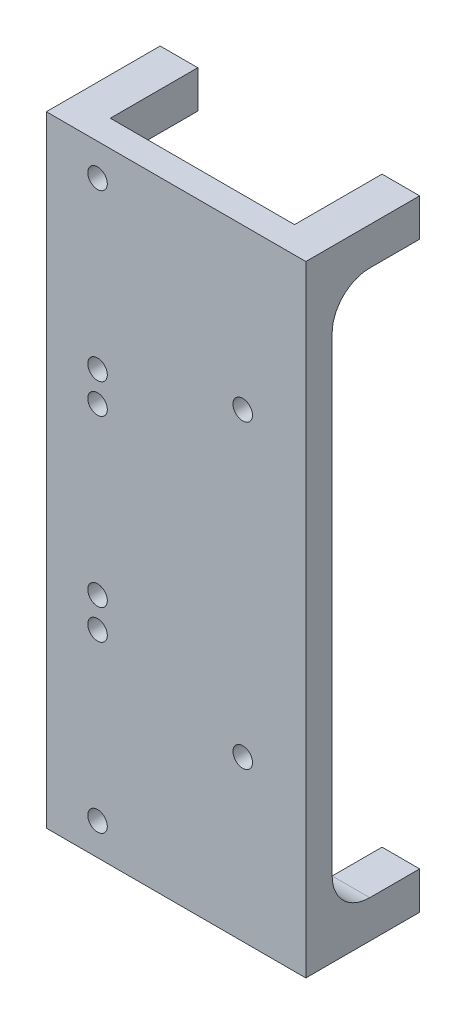
from build123d import *

# Parameters (mm, degrees)
SKETCH1_W            = 69
SKETCH1_H            = 165
BOSS_EXTRUDE1_DEPTH  = 7
SKETCH3_R            = 2.6
CUT_EXTRUDE2_DEPTH   = 7
SKETCH2_R            = 2.6
CUT_EXTRUDE1_DEPTH   = 7
SKETCH5_W            = 10
SKETCH5_H            = 10
BOSS_EXTRUDE2_DEPTH  = 23.264128691
SKETCH6_R            = 2.25
CUT_EXTRUDE3_DEPTH   = 10
FILLET1_R            = 10
FILLET1_OF_MIRROR1_R = 10
MIRROR2_START        = 123.910418582
MIRROR2_DEPTH        = 2.75
MIRROR2_START_2      = 116.660418582
MIRROR2_2_DEPTH      = 2.7499999
MIRROR2_START_3      = 119.410418482
MIRROR2_3_DEPTH      = 4.5000001
MIRROR2_START_4      = -23.264128691
MIRROR2_4_OUTLINE_R  = 2.25
MIRROR2_4_DEPTH      = 10


with BuildPart() as part:
    # Sketch1 → Boss-Extrude1 (new body)
    with BuildSketch(Plane.XY):
        with Locations((92.160418582, 14.328579343)):
            Rectangle(SKETCH1_W, SKETCH1_H)
    extrude(amount=BOSS_EXTRUDE1_DEPTH)

    # Sketch3 → Cut-Extrude2 (cut)
    with BuildSketch(Plane.XY.offset(7)):
        with Locations((109.883329943, 54.328579343)):
            Circle(SKETCH3_R)
        with Locations((109.883329943, -25.671420657)):
            Circle(SKETCH3_R)
    extrude(amount=-CUT_EXTRUDE2_DEPTH, mode=Mode.SUBTRACT)

    # Sketch2 → Cut-Extrude1 (cut)
    with BuildSketch(Plane.XY.offset(7)):
        with Locations((71.267526747, -59.671420657)):
            Circle(SKETCH2_R)
        with Locations((71.267526747, -15.671420657)):
            Circle(SKETCH2_R)
        with Locations((71.267526747, -7.671420657)):
            Circle(SKETCH2_R)
        with Locations((71.267526747, 36.328579343)):
            Circle(SKETCH2_R)
        with Locations((71.267526747, 44.328579343)):
            Circle(SKETCH2_R)
        with Locations((71.267526747, 88.328579343)):
            Circle(SKETCH2_R)
    extrude(amount=-CUT_EXTRUDE1_DEPTH, mode=Mode.SUBTRACT)

    # Sketch5 → Boss-Extrude2 (add)
    with BuildSketch(Plane(origin=(0, 0, 0), x_dir=(-1, 0, 0), z_dir=(0, 0, -1))):
        with Locations((-62.660418582, -63.171420657)):
            Rectangle(SKETCH5_W, SKETCH5_H)
    boss_extrude2 = extrude(amount=BOSS_EXTRUDE2_DEPTH)

    # Sketch6 → Cut-Extrude3 (cut)
    with BuildSketch(Plane(origin=(0, 0, -23.264128691), x_dir=(-1, 0, 0), z_dir=(0, 0, -1))):
        with Locations(Location((-62.660418582, -63.171420657, 0), (0, 0, 90))):
            Circle(SKETCH6_R)
    cut_extrude3 = extrude(amount=-CUT_EXTRUDE3_DEPTH, mode=Mode.SUBTRACT)

    # Fillet1
    fillet1_edges = [part.edges().sort_by_distance(p)[0] for p in [
        (62.660418582, -58.171420657, 0),
    ]]
    fillet(fillet1_edges, radius=FILLET1_R)

    # Mirror1: Boss-Extrude2, Cut-Extrude3 across plane
    add(boss_extrude2.mirror(Plane(origin=(0, 14.328579343, 0), x_dir=(0, 0, 1), z_dir=(0, -1, 0))))
    add(cut_extrude3.mirror(Plane(origin=(0, 14.328579343, 0), x_dir=(0, 0, 1), z_dir=(0, -1, 0))), mode=Mode.SUBTRACT)

    # Fillet1 of Mirror1
    fillet1_of_mirror1_edges = [part.edges().sort_by_distance(p)[0] for p in [
        (62.660418582, 86.828579343, 0),
    ]]
    fillet(fillet1_of_mirror1_edges, radius=FILLET1_OF_MIRROR1_R)

    # Mirror2: read off the stored shape, not the designer's step
    # Mirror2 outline → Mirror2 (add)
    with BuildSketch(Plane.YZ.offset(MIRROR2_START)):
        with BuildLine():
            ThreePointArc((-58.171420657, -10), (-55.242488469, -2.928932188), (-48.171420657, 0))
            Line((-48.171420657, 0), (-68.171420657, 0))
            Line((-68.171420657, 0), (-68.171420657, -23.264128691))
            Line((-68.171420657, -23.264128691), (-58.171420657, -23.264128691))
            Line((-58.171420657, -23.264128691), (-58.171420657, -10))
        make_face()
        with BuildLine():
            Line((96.828579343, -23.264128691), (96.828579343, 0))
            Line((96.828579343, 0), (76.828579343, 0))
            ThreePointArc((76.828579343, 0), (83.899647155, -2.928932188), (86.828579343, -10))
            Line((86.828579343, -10), (86.828579343, -23.264128691))
            Line((86.828579343, -23.264128691), (96.828579343, -23.264128691))
        make_face()
    extrude(amount=MIRROR2_DEPTH)

    # Mirror2 2 outline → Mirror2 2 (add)
    with BuildSketch(Plane.YZ.offset(MIRROR2_START_2)):
        with BuildLine():
            ThreePointArc((-58.171420657, -10), (-55.242488469, -2.928932188), (-48.171420657, 0))
            Line((-48.171420657, 0), (-68.171420657, 0))
            Line((-68.171420657, 0), (-68.171420657, -23.264128691))
            Line((-68.171420657, -23.264128691), (-58.171420657, -23.264128691))
            Line((-58.171420657, -23.264128691), (-58.171420657, -10))
        make_face()
        with BuildLine():
            Line((96.828579343, -23.264128691), (96.828579343, 0))
            Line((96.828579343, 0), (76.828579343, 0))
            ThreePointArc((76.828579343, 0), (83.899647155, -2.928932188), (86.828579343, -10))
            Line((86.828579343, -10), (86.828579343, -23.264128691))
            Line((86.828579343, -23.264128691), (96.828579343, -23.264128691))
        make_face()
    extrude(amount=MIRROR2_2_DEPTH)

    # Mirror2 3 outline → Mirror2 3 (add)
    with BuildSketch(Plane.YZ.offset(MIRROR2_START_3)):
        with BuildLine():
            Line((-68.171420657, -23.264128691), (-58.171420657, -23.264128691))
            Line((-58.171420657, -23.264128691), (-58.171420657, -10))
            ThreePointArc((-58.171420657, -10), (-55.242488469, -2.928932188), (-48.171420657, 0))
            Line((-48.171420657, 0), (-68.171420657, 0))
            Line((-68.171420657, 0), (-68.171420657, -23.264128691))
        make_face()
        with BuildLine():
            Line((96.828579343, 0), (76.828579343, 0))
            ThreePointArc((76.828579343, 0), (83.899647155, -2.928932188), (86.828579343, -10))
            Line((86.828579343, -10), (86.828579343, -23.264128691))
            Line((86.828579343, -23.264128691), (96.828579343, -23.264128691))
            Line((96.828579343, -23.264128691), (96.828579343, 0))
        make_face()
    extrude(amount=MIRROR2_3_DEPTH)

    # Mirror2 4 outline → Mirror2 4 (cut)
    with BuildSketch(Plane.XY.offset(MIRROR2_START_4)):
        with Locations((121.660418582, -63.171420657)):
            Circle(MIRROR2_4_OUTLINE_R)
        with Locations((121.660418582, 91.828579343)):
            Circle(MIRROR2_4_OUTLINE_R)
    extrude(amount=MIRROR2_4_DEPTH, mode=Mode.SUBTRACT)


solid = part.part
